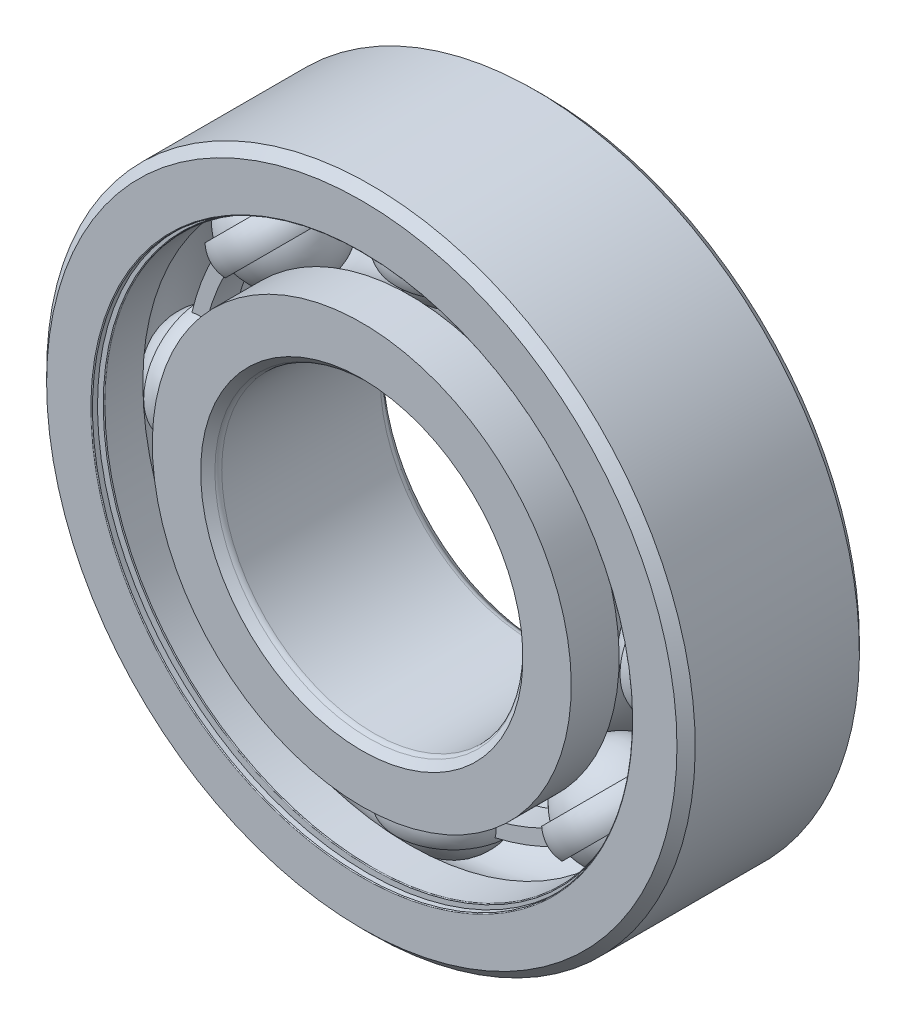
from build123d import *

# Parameters (mm, degrees)
BOSS_EXTRUDE1_DEPTH = 0.75
CIRPATTERN1_COUNT   = 8
CIRPATTERN2_COUNT   = 8
FILLET1_R           = 0.0405
FILLET2_R           = 0.3375


with BuildPart() as part:
    # Sketch3 → Revolve1 (revolve)
    with BuildSketch(Plane(origin=(0, 0, 0), x_dir=(0, 0, -1), z_dir=(1, 0, 0))):
        with BuildLine():
            Line((4.05, 16), (4.5, 15.55))
            Line((4.5, 15.55), (4.5, 13.165384615))
            Line((4.5, 13.165384615), (2.1375, 13.165384615))
            ThreePointArc((2.1375, 13.165384615), (0, 14.313634112), (-2.1375, 13.165384615))
            Line((-2.1375, 13.165384615), (-4.5, 13.165384615))
            Line((-4.5, 13.165384615), (-4.5, 15.55))
            Line((-4.5, 15.55), (-4.05, 16))
            Line((-4.05, 16), (4.05, 16))
        make_face()
    revolve(axis=Axis((0, 0, 4.5), (0, 0, -1)))

    # Sketch8 → Cut-Revolve1 (revolve, cut)
    with BuildSketch(Plane(origin=(0, 0, 0), x_dir=(0, 0, -1), z_dir=(1, 0, 0))):
        Polygon((-4.212, 13.165384615), (-4.05, 13.165384615), (-4.05, 14.11025641), (-4.212, 14.11025641), (-4.212, 13.327384615), (-4.5, 13.327384615), (-4.5, 13.165384615), align=None)
        Polygon((4.05, 13.165384615), (4.212, 13.165384615), (4.5, 13.165384615), (4.5, 13.327384615), (4.212, 13.327384615), (4.212, 14.11025641), (4.05, 14.11025641), align=None)
    revolve(axis=Axis((0, 0, 4.5), (0, 0, -1)), mode=Mode.SUBTRACT)

    # Fillet1
    fillet1_edges = [part.edges().sort_by_distance(p)[0] for p in [
        (0, -13.165384615, -4.05),
        (0, -13.327384615, -4.5),
        (0, -13.165384615, 4.05),
        (0, -13.327384615, 4.5),
    ]]
    fillet(fillet1_edges, radius=FILLET1_R)


with BuildPart() as body_2:
    # Sketch4 → Revolve2 (revolve)
    with BuildSketch(Plane(origin=(0, 0, 0), x_dir=(0, 0, -1), z_dir=(1, 0, 0))):
        with BuildLine():
            Line((-4.05, 7.5), (-4.5, 7.95))
            Line((-4.5, 7.95), (-4.5, 10.334615385))
            Line((-4.5, 10.334615385), (-2.1375, 10.334615385))
            ThreePointArc((-2.1375, 10.334615385), (0, 9.186365888), (2.1375, 10.334615385))
            Line((2.1375, 10.334615385), (4.5, 10.334615385))
            Line((4.5, 10.334615385), (4.5, 7.95))
            Line((4.5, 7.95), (4.05, 7.5))
            Line((4.05, 7.5), (-4.05, 7.5))
        make_face()
    revolve(axis=Axis((0, 0, 4.5), (0, 0, -1)))

    # Fillet2
    fillet2_edges = [body_2.edges().sort_by_distance(p)[0] for p in [
        (0, -7.5, -4.05),
        (0, -7.5, 4.05),
    ]]
    fillet(fillet2_edges, radius=FILLET2_R)


with BuildPart() as body_3:
    # Sketch5 → Revolve3 (revolve)
    with BuildSketch(Plane(origin=(0, 0, 0), x_dir=(0, 0, -1), z_dir=(1, 0, 0))):
        with BuildLine():
            Line((-2.563634112, 11.75), (2.563634112, 11.75))
            ThreePointArc((2.563634112, 11.75), (0, 14.313634112), (-2.563634112, 11.75))
        make_face()
    revolve(axis=Axis((0, 11.75, 2.563634112), (0, 0, -1)))


with BuildPart() as body_4:
    # Sketch6 → Revolve4 (revolve)
    with BuildSketch(Plane(origin=(0, 0, 0), x_dir=(0, 0, -1), z_dir=(1, 0, 0))):
        with BuildLine():
            Line((-2.46401937, 12.457692308), (-2.803349475, 12.457692308))
            ThreePointArc((-2.803349475, 12.457692308), (-2.973014528, 11.75), (-2.803349475, 11.042307692))
            Line((-2.803349475, 11.042307692), (-2.46401937, 11.042307692))
            ThreePointArc((-2.46401937, 11.042307692), (-2.563634112, 11.75), (-2.46401937, 12.457692308))
        make_face()
    revolve4 = revolve(axis=Axis((0, 16, 0), (0, -1, 0)))

    # Sketch7 → Boss-Extrude1 (add, symmetric)
    with BuildSketch(Plane.XY):
        with BuildLine():
            Line((8.308504679, 8.308504679), (8.808918709, 8.808918709))
            ThreePointArc((8.808918709, 8.808918709), (4.767352452, 11.509406945), (0, 12.457692308))
            Line((0, 12.457692308), (0, 11.75))
            ThreePointArc((0, 11.75), (4.49653033, 10.855584507), (8.308504679, 8.308504679))
        make_face()
    boss_extrude1 = extrude(amount=BOSS_EXTRUDE1_DEPTH, both=True)

    # CirPattern2: Revolve4, Boss-Extrude1 ×8 about axis
    cirpattern2_axis = Axis((0, 0, 4.5), (0, 0, -1))
    add([revolve4.rotate(cirpattern2_axis, i * 360 / CIRPATTERN2_COUNT) for i in range(1, CIRPATTERN2_COUNT)])
    add([boss_extrude1.rotate(cirpattern2_axis, i * 360 / CIRPATTERN2_COUNT) for i in range(1, CIRPATTERN2_COUNT)])


with BuildPart() as cirpattern1_1:
    # CirPattern1: pattern copy
    add(body_3.part.rotate(Axis((0, 0, 4.5), (0, 0, -1)), 1 * 360 / CIRPATTERN1_COUNT))


with BuildPart() as cirpattern1_2:
    # CirPattern1: pattern copy
    add(body_3.part.rotate(Axis((0, 0, 4.5), (0, 0, -1)), 2 * 360 / CIRPATTERN1_COUNT))


with BuildPart() as cirpattern1_3:
    # CirPattern1: pattern copy
    add(body_3.part.rotate(Axis((0, 0, 4.5), (0, 0, -1)), 3 * 360 / CIRPATTERN1_COUNT))


with BuildPart() as cirpattern1_4:
    # CirPattern1: pattern copy
    add(body_3.part.rotate(Axis((0, 0, 4.5), (0, 0, -1)), 4 * 360 / CIRPATTERN1_COUNT))


with BuildPart() as cirpattern1_5:
    # CirPattern1: pattern copy
    add(body_3.part.rotate(Axis((0, 0, 4.5), (0, 0, -1)), 5 * 360 / CIRPATTERN1_COUNT))


with BuildPart() as cirpattern1_6:
    # CirPattern1: pattern copy
    add(body_3.part.rotate(Axis((0, 0, 4.5), (0, 0, -1)), 6 * 360 / CIRPATTERN1_COUNT))


with BuildPart() as cirpattern1_7:
    # CirPattern1: pattern copy
    add(body_3.part.rotate(Axis((0, 0, 4.5), (0, 0, -1)), 7 * 360 / CIRPATTERN1_COUNT))


solid = Compound([part.part, body_2.part, body_3.part, body_4.part, cirpattern1_1.part, cirpattern1_2.part, cirpattern1_3.part, cirpattern1_4.part, cirpattern1_5.part, cirpattern1_6.part, cirpattern1_7.part])
